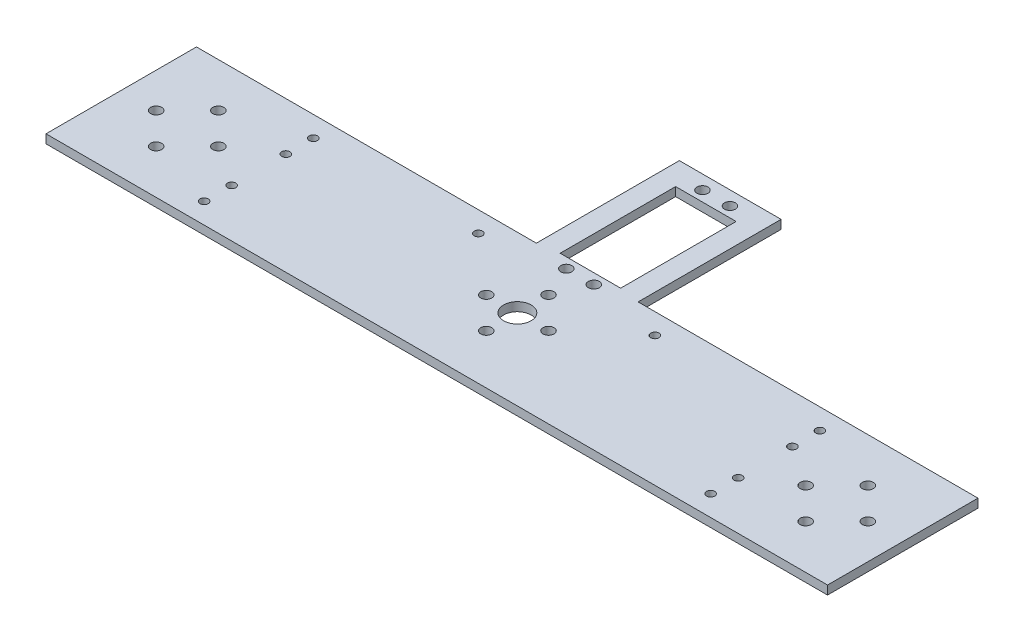
from build123d import *

# Parameters (mm, degrees)
SKETCH1_R           = 5
SKETCH1_R_2         = 2
BOSS_EXTRUDE1_DEPTH = 3.175
SKETCH2_R           = 1.5
CUT_EXTRUDE1_DEPTH  = 10
SKETCH3_R           = 2
CUT_EXTRUDE2_DEPTH  = 10


with BuildPart() as part:
    # Sketch1 → Boss-Extrude1 (new body)
    with BuildSketch(Plane(origin=(0, 0, 0), x_dir=(1, 0, 0), z_dir=(0, 1, 0))):
        Polygon((284.2, 0), (160.6, 0), (160.6, 52), (123.6, 52), (123.6, 0), (0, 0), (0, -54.713708499), (284.2, -54.713708499), align=None)
        with Locations((142.1, -25.4)):
            Circle(SKETCH1_R, mode=Mode.SUBTRACT)
        with Locations((142.1, -14.086291501)):
            Circle(SKETCH1_R_2, mode=Mode.SUBTRACT)
        with Locations((153.413708499, -25.4)):
            Circle(SKETCH1_R_2, mode=Mode.SUBTRACT)
        with Locations((130.786291501, -25.4)):
            Circle(SKETCH1_R_2, mode=Mode.SUBTRACT)
        with Locations((147.1, -2.6025933)):
            Circle(SKETCH1_R_2, mode=Mode.SUBTRACT)
        with Locations((142.1, -36.713708499)):
            Circle(SKETCH1_R_2, mode=Mode.SUBTRACT)
        with Locations((137.1, -2.6025933)):
            Circle(SKETCH1_R_2, mode=Mode.SUBTRACT)
        with Locations((137.1, 46.8974067)):
            Circle(SKETCH1_R_2, mode=Mode.SUBTRACT)
        Polygon((153.1, 1.1474067), (142.1, 1.1474067), (131.1, 1.1474067), (131.1, 43.1474067), (142.1, 43.1474067), (153.1, 43.1474067), align=None, mode=Mode.SUBTRACT)
        with Locations((147.1, 46.8974067)):
            Circle(SKETCH1_R_2, mode=Mode.SUBTRACT)
    extrude(amount=BOSS_EXTRUDE1_DEPTH)

    # Sketch2 → Cut-Extrude1 (cut)
    with BuildSketch(Plane.XZ):
        with Locations((50, 47.213708499)):
            Circle(SKETCH2_R)
        with Locations((50, 7.5)):
            Circle(SKETCH2_R)
        with Locations((110, 7.5)):
            Circle(SKETCH2_R)
        with Locations((174.2, 7.5)):
            Circle(SKETCH2_R)
        with Locations((234.2, 7.5)):
            Circle(SKETCH2_R)
        with Locations((234.2, 47.213708499)):
            Circle(SKETCH2_R)
        with Locations((50, 37.213708499)):
            Circle(SKETCH2_R)
        with Locations((50, 17.5)):
            Circle(SKETCH2_R)
        with Locations((234.2, 37.213708499)):
            Circle(SKETCH2_R)
        with Locations((234.2, 17.5)):
            Circle(SKETCH2_R)
    extrude(amount=-CUT_EXTRUDE1_DEPTH, mode=Mode.SUBTRACT)

    # Sketch3 → Cut-Extrude2 (cut)
    with BuildSketch(Plane.XZ):
        with Locations((24, 38.670562748)):
            Circle(SKETCH3_R)
        with Locations((12.686291501, 27.356854249)):
            Circle(SKETCH3_R)
        with Locations((35.313708499, 27.356854249)):
            Circle(SKETCH3_R)
        with Locations((24, 16.043145751)):
            Circle(SKETCH3_R)
        with Locations((260.2, 16.043145751)):
            Circle(SKETCH3_R)
        with Locations((271.513708499, 27.356854249)):
            Circle(SKETCH3_R)
        with Locations((260.2, 38.670562748)):
            Circle(SKETCH3_R)
        with Locations((248.886291501, 27.356854249)):
            Circle(SKETCH3_R)
    extrude(amount=-CUT_EXTRUDE2_DEPTH, mode=Mode.SUBTRACT)


solid = part.part
